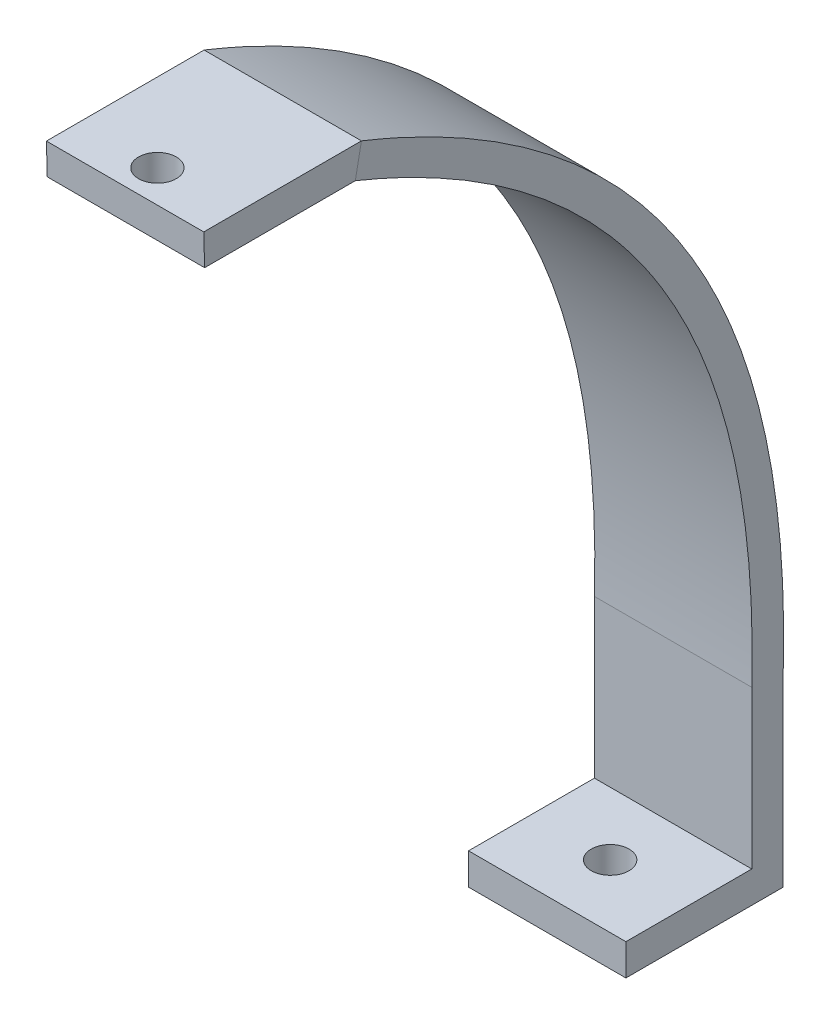
from build123d import *

# Parameters (mm, degrees)
SKETCH2_W                = 10
SKETCH2_H                = 10
BOSS_EXTRUDE1_DEPTH      = 2
M2_CLEARANCE_HOLE1_D     = 2.4
M2_CLEARANCE_HOLE1_DEPTH = 2
M2_CLEARANCE_HOLE1_TIP   = 0.721032743
SKETCH5_W                = 10
SKETCH5_H                = 2
BOSS_EXTRUDE2_DEPTH      = 10
SWEEP1_START             = -5
SWEEP1_DEPTH             = 10
M2_CLEARANCE_HOLE2_D     = 2.4


# Read off the part's stored shape, not the designer's step: Sweep1
with BuildPart() as part:
    # Sketch2 → Boss-Extrude1 (new body)
    with BuildSketch(Plane(origin=(0, 0, 0), x_dir=(1, 0, 0), z_dir=(0, 1, 0))):
        Rectangle(SKETCH2_W, SKETCH2_H)
    extrude(amount=BOSS_EXTRUDE1_DEPTH)

    # M2 Clearance Hole1
    with Locations(Plane(origin=(0, 0, 0), x_dir=(-1, 0, 0), z_dir=(0, -1, 0))):
        with Locations((0, -1)):
            Hole(M2_CLEARANCE_HOLE1_D / 2, depth=M2_CLEARANCE_HOLE1_DEPTH)
            with Locations((0, 0, -(M2_CLEARANCE_HOLE1_DEPTH + M2_CLEARANCE_HOLE1_TIP / 2))):  # 118° drill point
                Cone(0, M2_CLEARANCE_HOLE1_D / 2, M2_CLEARANCE_HOLE1_TIP, mode=Mode.SUBTRACT)

    # Sketch5 → Boss-Extrude2 (add)
    with BuildSketch(Plane(origin=(0, 2, 0), x_dir=(1, 0, 0), z_dir=(0, 1, 0))):
        with Locations((0, 4)):
            Rectangle(SKETCH5_W, SKETCH5_H)
    extrude(amount=BOSS_EXTRUDE2_DEPTH)

    # Sweep1 outline → Sweep1 (add)
    with BuildSketch(Plane.YZ.offset(SWEEP1_START)):
        with BuildLine():
            add(Edge.make_bspline(
                [(12, -3), (22.081437319, -3.280824846), (30.428491616, -1.29359039), (43.829554593, 7.091969611), (48.931984519, 13.47592334), (52.477312717, 22.194576498)],
                knots=[0, 0, 0, 0, 0.5, 0.5, 0.99708935, 0.99708935, 0.99708935, 0.99708935], degree=3))
            Line((12, -3), (12, -5))
            add(Edge.make_bspline(
                [(12, -5), (22.363265836, -5.280469752), (31.151391085, -3.215010639), (41.80972213, 3.477460348), (44.938271104, 6.304066685), (48.978333418, 11.413324262), (50.216569106, 13.261147564), (52.476984989, 17.242675991), (53.506405959, 19.395799121), (54.435317643, 21.703901173), (54.455920091, 21.755052947), (54.476559414, 21.806291518)],
                knots=[0, 0, 0, 0, 0.5, 0.5, 0.75, 0.75, 0.875, 0.875, 1, 1, 1.002873769, 1.002873769, 1.002873769, 1.002873769], degree=3))
            Line((54.476559414, 21.806291518), (54.476559414, 31.827443689))
            Line((54.476559414, 31.827443689), (52.477312712, 31.772556311))
            Line((52.477312712, 31.772556311), (52.477312717, 22.194576498))
        make_face()
    extrude(amount=SWEEP1_DEPTH)

    # M2 Clearance Hole2 (through all)
    with Locations(Plane(origin=(0, 52.477312712, 0), x_dir=(-1, 0, 0), z_dir=(0, -1, 0))):
        with Locations((0, -29.772556311)):
            Hole(M2_CLEARANCE_HOLE2_D / 2)


solid = part.part
